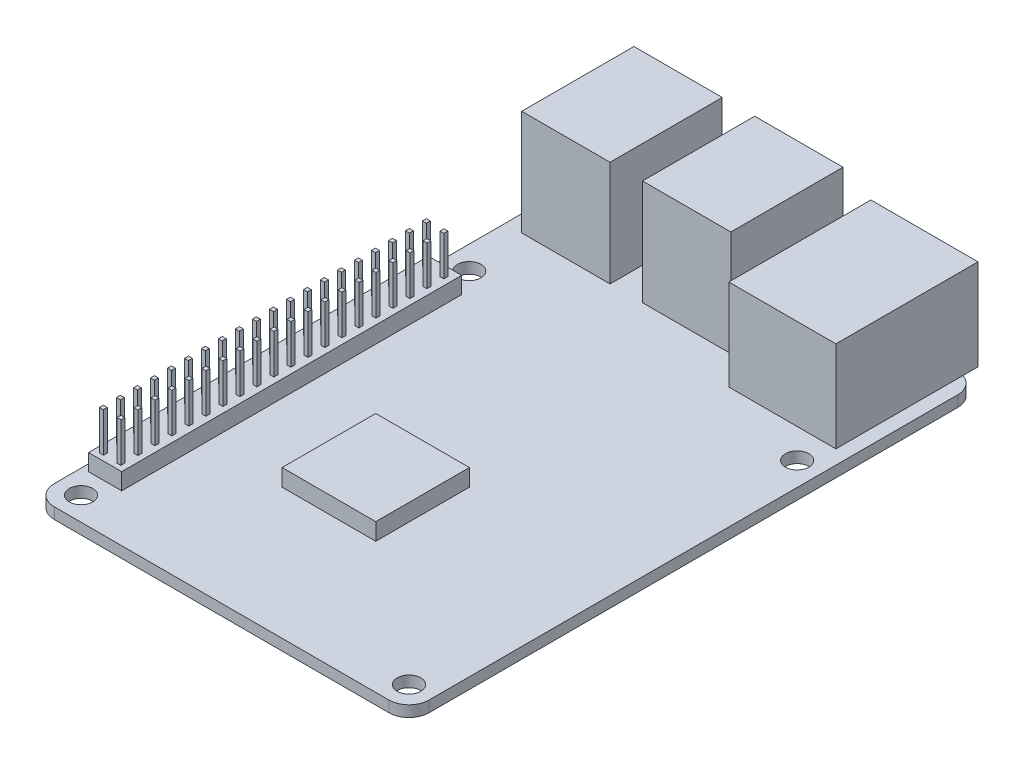
from build123d import *

# Parameters (mm, degrees)
SKETCH1_R           = 1.75
BOSS_EXTRUDE1_DEPTH = 1.651
SKETCH2_W           = 13.1953
SKETCH2_H           = 16.764
BOSS_EXTRUDE2_DEPTH = 15.748
SKETCH4_W           = 16.002
SKETCH4_H           = 21.23186
BOSS_EXTRUDE3_DEPTH = 13.589
SKETCH3_W           = 10.6553
SKETCH3_H           = 5.969
SKETCH3_W_2         = 13.462
SKETCH3_H_2         = 11.049
CUT_EXTRUDE1_DEPTH  = 15.748
SKETCH5_W           = 4.953
SKETCH5_H           = 50.8
BOSS_EXTRUDE4_DEPTH = 2.4892
SKETCH6_W           = 0.5969
SKETCH6_H           = 0.5969
BOSS_EXTRUDE5_DEPTH = 5.8928
SKETCH7_W           = 13.9954
SKETCH7_H           = 13.9954
BOSS_EXTRUDE6_DEPTH = 2.54


with BuildPart() as part:
    # Sketch1 → Boss-Extrude1 (new body)
    with BuildSketch(Plane(origin=(0, 0, 0), x_dir=(1, 0, 0), z_dir=(0, 1, 0))):
        with BuildLine():
            Line((-25, -42.5), (25, -42.5))
            ThreePointArc((25, -42.5), (27.121320344, -41.621320344), (28, -39.5))
            Line((28, -39.5), (28, 39.5))
            ThreePointArc((28, 39.5), (27.121320344, 41.621320344), (25, 42.5))
            Line((25, 42.5), (-25, 42.5))
            ThreePointArc((-25, 42.5), (-27.121320344, 41.621320344), (-28, 39.5))
            Line((-28, 39.5), (-28, -39.5))
            ThreePointArc((-28, -39.5), (-27.121320344, -41.621320344), (-25, -42.5))
        make_face()
        with Locations((24.5, 19)):
            Circle(SKETCH1_R, mode=Mode.SUBTRACT)
        with Locations((-24.5, 19)):
            Circle(SKETCH1_R, mode=Mode.SUBTRACT)
        with Locations((-24.5, -39)):
            Circle(SKETCH1_R, mode=Mode.SUBTRACT)
        with Locations((24.5, -39)):
            Circle(SKETCH1_R, mode=Mode.SUBTRACT)
    extrude(amount=BOSS_EXTRUDE1_DEPTH)

    # Sketch2 → Boss-Extrude2 (add)
    with BuildSketch(Plane(origin=(0, 1.651, 0), x_dir=(1, 0, 0), z_dir=(0, 1, 0))):
        with Locations((-18.91315, 36.2389)):
            Rectangle(SKETCH2_W, SKETCH2_H)
        with Locations((-0.86645, 36.2389)):
            Rectangle(SKETCH2_W, SKETCH2_H)
    extrude(amount=BOSS_EXTRUDE2_DEPTH)

    # Sketch4 → Boss-Extrude3 (add)
    with BuildSketch(Plane(origin=(0, 1.651, 0), x_dir=(1, 0, 0), z_dir=(0, 1, 0))):
        with Locations((17.8978, 34.00497)):
            Rectangle(SKETCH4_W, SKETCH4_H)
    extrude(amount=BOSS_EXTRUDE3_DEPTH)

    # Sketch3 → Cut-Extrude1 (cut)
    with BuildSketch(Plane(origin=(0, 0, -44.6209), x_dir=(-1, 0, 0), z_dir=(0, 0, -1))):
        with Locations((18.91315, 5.9055)):
            Rectangle(SKETCH3_W, SKETCH3_H)
        with Locations((18.91315, 13.1445)):
            Rectangle(SKETCH3_W, SKETCH3_H)
        with Locations((0.86645, 5.9055)):
            Rectangle(SKETCH3_W, SKETCH3_H)
        with Locations((0.86645, 13.1445)):
            Rectangle(SKETCH3_W, SKETCH3_H)
        with Locations((-17.8978, 8.4455)):
            Rectangle(SKETCH3_W_2, SKETCH3_H_2)
    extrude(amount=-CUT_EXTRUDE1_DEPTH, mode=Mode.SUBTRACT)

    # Sketch5 → Boss-Extrude4 (add)
    with BuildSketch(Plane(origin=(0, 1.651, 0), x_dir=(1, 0, 0), z_dir=(0, 1, 0))):
        with Locations((-24.5, -10)):
            Rectangle(SKETCH5_W, SKETCH5_H)
    extrude(amount=BOSS_EXTRUDE4_DEPTH)

    # Sketch6 → Boss-Extrude5 (add)
    with BuildSketch(Plane(origin=(0, 4.1402, 0), x_dir=(1, 0, 0), z_dir=(0, 1, 0))):
        with Locations((-25.8081, 13.90775)):
            Rectangle(SKETCH6_W, SKETCH6_H)
        with Locations((-23.1919, 13.90775)):
            Rectangle(SKETCH6_W, SKETCH6_H)
        with Locations((-25.8081, 11.36775)):
            Rectangle(SKETCH6_W, SKETCH6_H)
        with Locations((-23.1919, 11.36775)):
            Rectangle(SKETCH6_W, SKETCH6_H)
        with Locations((-25.8081, 8.82775)):
            Rectangle(SKETCH6_W, SKETCH6_H)
        with Locations((-23.1919, 8.82775)):
            Rectangle(SKETCH6_W, SKETCH6_H)
        with Locations((-25.8081, 6.28775)):
            Rectangle(SKETCH6_W, SKETCH6_H)
        with Locations((-23.1919, 6.28775)):
            Rectangle(SKETCH6_W, SKETCH6_H)
        with Locations((-25.8081, 3.74775)):
            Rectangle(SKETCH6_W, SKETCH6_H)
        with Locations((-23.1919, 3.74775)):
            Rectangle(SKETCH6_W, SKETCH6_H)
        with Locations((-25.8081, 1.20775)):
            Rectangle(SKETCH6_W, SKETCH6_H)
        with Locations((-23.1919, 1.20775)):
            Rectangle(SKETCH6_W, SKETCH6_H)
        with Locations((-25.8081, -1.33225)):
            Rectangle(SKETCH6_W, SKETCH6_H)
        with Locations((-23.1919, -1.33225)):
            Rectangle(SKETCH6_W, SKETCH6_H)
        with Locations((-25.8081, -3.87225)):
            Rectangle(SKETCH6_W, SKETCH6_H)
        with Locations((-23.1919, -3.87225)):
            Rectangle(SKETCH6_W, SKETCH6_H)
        with Locations((-25.8081, -6.41225)):
            Rectangle(SKETCH6_W, SKETCH6_H)
        with Locations((-23.1919, -6.41225)):
            Rectangle(SKETCH6_W, SKETCH6_H)
        with Locations((-25.8081, -8.95225)):
            Rectangle(SKETCH6_W, SKETCH6_H)
        with Locations((-23.1919, -8.95225)):
            Rectangle(SKETCH6_W, SKETCH6_H)
        with Locations((-25.8081, -11.49225)):
            Rectangle(SKETCH6_W, SKETCH6_H)
        with Locations((-23.1919, -11.49225)):
            Rectangle(SKETCH6_W, SKETCH6_H)
        with Locations((-25.8081, -14.03225)):
            Rectangle(SKETCH6_W, SKETCH6_H)
        with Locations((-23.1919, -14.03225)):
            Rectangle(SKETCH6_W, SKETCH6_H)
        with Locations((-25.8081, -16.57225)):
            Rectangle(SKETCH6_W, SKETCH6_H)
        with Locations((-23.1919, -16.57225)):
            Rectangle(SKETCH6_W, SKETCH6_H)
        with Locations((-25.8081, -19.11225)):
            Rectangle(SKETCH6_W, SKETCH6_H)
        with Locations((-23.1919, -19.11225)):
            Rectangle(SKETCH6_W, SKETCH6_H)
        with Locations((-25.8081, -21.65225)):
            Rectangle(SKETCH6_W, SKETCH6_H)
        with Locations((-23.1919, -21.65225)):
            Rectangle(SKETCH6_W, SKETCH6_H)
        with Locations((-25.8081, -24.19225)):
            Rectangle(SKETCH6_W, SKETCH6_H)
        with Locations((-23.1919, -24.19225)):
            Rectangle(SKETCH6_W, SKETCH6_H)
        with Locations((-25.8081, -26.73225)):
            Rectangle(SKETCH6_W, SKETCH6_H)
        with Locations((-23.1919, -26.73225)):
            Rectangle(SKETCH6_W, SKETCH6_H)
        with Locations((-25.8081, -29.27225)):
            Rectangle(SKETCH6_W, SKETCH6_H)
        with Locations((-23.1919, -29.27225)):
            Rectangle(SKETCH6_W, SKETCH6_H)
        with Locations((-25.8081, -31.81225)):
            Rectangle(SKETCH6_W, SKETCH6_H)
        with Locations((-23.1919, -31.81225)):
            Rectangle(SKETCH6_W, SKETCH6_H)
        with Locations((-25.8081, -34.35225)):
            Rectangle(SKETCH6_W, SKETCH6_H)
        with Locations((-23.1919, -34.35225)):
            Rectangle(SKETCH6_W, SKETCH6_H)
    extrude(amount=BOSS_EXTRUDE5_DEPTH)

    # Sketch7 → Boss-Extrude6 (add)
    with BuildSketch(Plane(origin=(0, 1.651, 0), x_dir=(1, 0, 0), z_dir=(0, 1, 0))):
        with Locations((-3.5196, -15.9443)):
            Rectangle(SKETCH7_W, SKETCH7_H)
    extrude(amount=BOSS_EXTRUDE6_DEPTH)


solid = part.part
